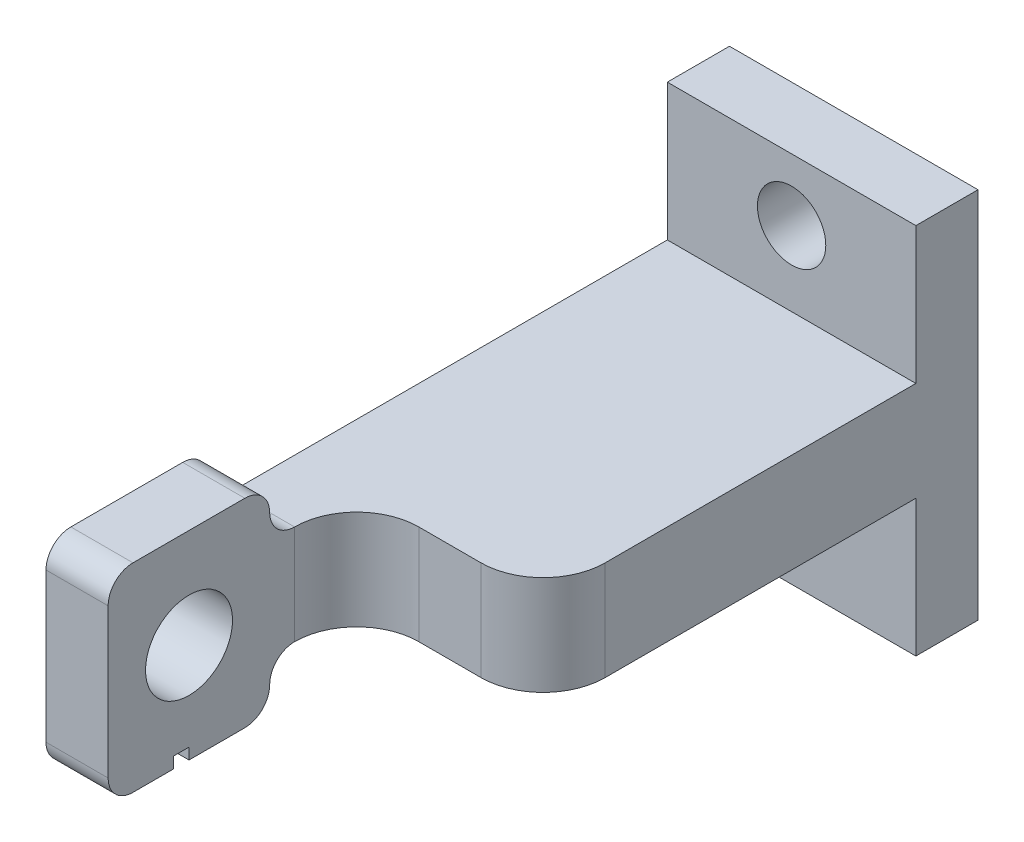
from build123d import *

# Parameters (mm, degrees)
SKETCH1_R               = 2.75
BOSS_EXTRUDE1_DEPTH     = 5
SKETCH2_W               = 20
SKETCH2_H               = 4
BOSS_EXTRUDE2_DEPTH     = 50
CUT_EXTRUDE1_DEPTH      = 73.479956342
CUT_EXTRUDE1_DEPTH_BACK = 73.479956342
SKETCH5_W               = 15
SKETCH5_H               = 8
CUT_EXTRUDE2_DEPTH      = 15
SKETCH6_W               = 15
SKETCH6_H               = 8
CUT_EXTRUDE3_DEPTH      = 5
FILLET1_R               = 5
SKETCH7_W               = 13
SKETCH7_H               = 4
BOSS_EXTRUDE3_DEPTH     = 5
SKETCH8_R               = 3.5
CUT_EXTRUDE5_DEPTH      = 73.479956342
SKETCH9_W               = 1.25
SKETCH9_H               = 0.9
SKETCH9_H_2             = 0.5
CUT_EXTRUDE6_DEPTH      = 5
FILLET2_R               = 2


with BuildPart() as part:
    # Sketch1 → Boss-Extrude1 (new body)
    with BuildSketch(Plane.XY):
        Polygon((15, -12.759140208), (25, -12.759140208), (25, -42.759140208), (5, -42.759140208), (5, -12.759140208), align=None)
        with Locations((15, -35.919713403)):
            Circle(SKETCH1_R, mode=Mode.SUBTRACT)
        with Locations((15, -17.759140208)):
            Circle(SKETCH1_R, mode=Mode.SUBTRACT)
    extrude(amount=BOSS_EXTRUDE1_DEPTH)

    # Sketch2 → Boss-Extrude2 (add)
    with BuildSketch(Plane.XY.offset(5)):
        with Locations((15, -25.759140208)):
            Rectangle(SKETCH2_W, SKETCH2_H)
        with Locations((15, -29.759140208)):
            Rectangle(SKETCH2_W, SKETCH2_H)
    extrude(amount=BOSS_EXTRUDE2_DEPTH)

    # Sketch3 → Cut-Extrude1 (cut, two sides: drawn at the far end of the back side and taken through both)
    with BuildSketch(Plane(origin=(25, 0, 0), x_dir=(0, 0, -1), z_dir=(1, 0, 0)).offset(-CUT_EXTRUDE1_DEPTH_BACK)):
        with BuildLine():
            Line((-46.695516884, -26.87718455), (-48.490552878, -27.759140208))
            Line((-48.490552878, -27.759140208), (-46.490552878, -27.759140208))
            ThreePointArc((-46.490552878, -27.759140208), (-46.542467666, -27.306410701), (-46.695516884, -26.87718455))
        make_face()
        with BuildLine():
            Line((-50.490552878, -27.759140208), (-48.490552878, -27.759140208))
            Line((-48.490552878, -27.759140208), (-46.695516884, -26.87718455))
            ThreePointArc((-46.695516884, -26.87718455), (-48.943282385, -25.811054996), (-50.490552878, -27.759140208))
        make_face()
        with BuildLine():
            Line((-46.490552878, -27.759140208), (-48.490552878, -27.759140208))
            Line((-48.490552878, -27.759140208), (-50.490552878, -27.759140208))
            ThreePointArc((-50.490552878, -27.759140208), (-48.490552878, -29.759140208), (-46.490552878, -27.759140208))
        make_face()
    extrude(amount=CUT_EXTRUDE1_DEPTH + CUT_EXTRUDE1_DEPTH_BACK, mode=Mode.SUBTRACT)

    # Sketch5 → Cut-Extrude2 (cut)
    with BuildSketch(Plane.XY.offset(55)):
        with Locations((17.5, -27.759140208)):
            Rectangle(SKETCH5_W, SKETCH5_H)
    extrude(amount=-CUT_EXTRUDE2_DEPTH, mode=Mode.SUBTRACT)

    # Sketch6 → Cut-Extrude3 (cut)
    with BuildSketch(Plane.XY.offset(40)):
        with Locations((17.5, -27.759140208)):
            Rectangle(SKETCH6_W, SKETCH6_H)
    extrude(amount=-CUT_EXTRUDE3_DEPTH, mode=Mode.SUBTRACT)

    # Fillet1
    fillet1_edges = [part.edges().sort_by_distance(p)[0] for p in [
        (10, -27.759140208, 35),
        (25, -27.759140208, 35),
    ]]
    fillet(fillet1_edges, radius=FILLET1_R)

    # Sketch7 → Boss-Extrude3 (add)
    with BuildSketch(Plane.ZY.offset(-5)):
        with Locations((48.5, -33.759140208)):
            Rectangle(SKETCH7_W, SKETCH7_H)
        with Locations((48.5, -21.759140208)):
            Rectangle(SKETCH7_W, SKETCH7_H)
    extrude(amount=-BOSS_EXTRUDE3_DEPTH)

    # Sketch8 → Cut-Extrude5 (cut, through all)
    with BuildSketch(Plane.ZY.offset(-5)):
        with Locations(Location((48.490552878, -27.759140208, 0), (0, 0, 270))):
            Circle(SKETCH8_R)
    extrude(amount=-CUT_EXTRUDE5_DEPTH, mode=Mode.SUBTRACT)

    # Sketch9 → Cut-Extrude6 (cut)
    with BuildSketch(Plane.ZY.offset(-5)):
        with Locations((49.115552878, -35.309140208)):
            Rectangle(SKETCH9_W, SKETCH9_H)
        with Locations((47.865552878, -36.009140208)):
            Rectangle(SKETCH9_W, SKETCH9_H_2)
        with Locations((49.115552878, -36.009140208)):
            Rectangle(SKETCH9_W, SKETCH9_H_2)
    extrude(amount=-CUT_EXTRUDE6_DEPTH, mode=Mode.SUBTRACT)

    # Fillet2
    fillet2_edges = [part.edges().sort_by_distance(p)[0] for p in [
        (7.5, -23.759140208, 42),
        (7.5, -31.759140208, 42),
        (7.5, -35.759140208, 42),
        (7.5, -19.759140208, 42),
        (7.5, -19.759140208, 55),
        (7.5, -35.759140208, 55),
    ]]
    fillet(fillet2_edges, radius=FILLET2_R - 0.0001)  # a hair under: the kernel refuses the full size


solid = part.part
